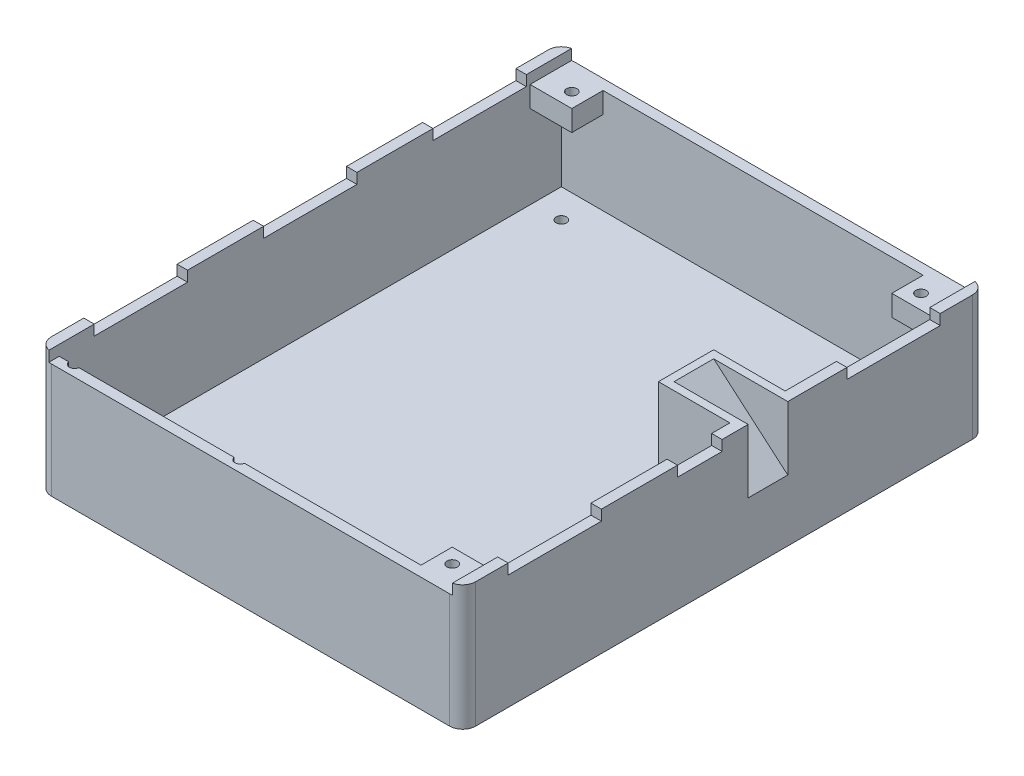
from build123d import *

# Parameters (mm, degrees)
BOSS_EXTRUDE2_DEPTH   = 4
SKETCH1_W             = 4.0000000000000036
SKETCH1_H             = 29.19999999999999
BOSS_EXTRUDE2_2_DEPTH = 4
BOSS_EXTRUDE2_3_DEPTH = 4
BOSS_EXTRUDE2_4_DEPTH = 4
SKETCH1_W_2           = 4
SKETCH1_H_2           = 17.435500273431558
BOSS_EXTRUDE2_5_DEPTH = 4
BOSS_EXTRUDE2_6_DEPTH = 4
BOSS_EXTRUDE2_7_DEPTH = 4
SKETCH1_H_3           = 17.43550027343155
BOSS_EXTRUDE2_8_DEPTH = 4
CUT_EXTRUDE1_DEPTH    = 4
SKETCH3_W             = 162.8
SKETCH3_H             = 200.6710005468631
BOSS_EXTRUDE3_DEPTH   = 40
SKETCH4_W             = 162.8
SKETCH4_H             = 200.6710005468631
BOSS_EXTRUDE4_DEPTH   = 4
FILLET1_R             = 5
FILLET2_R             = 5
FILLET3_R             = 5
FILLET4_R             = 5
SKETCH5_R             = 1.9999999999999967
SKETCH5_R_2           = 2
SKETCH5_R_3           = 2.0000000000000036
CUT_EXTRUDE2_DEPTH    = 4
BOSS_EXTRUDE5_DEPTH   = 8
SKETCH7_R             = 2.0000000000000036
CUT_EXTRUDE3_DEPTH    = 8
SKETCH8_W             = 16
SKETCH8_H             = 12
BOSS_EXTRUDE6_DEPTH   = 8
SKETCH9_R             = 1.9999999999999967
CUT_EXTRUDE4_DEPTH    = 8
SKETCH11_R            = 2
SKETCH11_R_2          = 1.9999999999999967
CUT_EXTRUDE5_DEPTH    = 8
SKETCH12_W            = 15.199999999999989
SKETCH12_H            = 20.419999999999987
CUT_EXTRUDE6_DEPTH    = 4
BOSS_EXTRUDE7_DEPTH   = 44
SKETCH14_W            = 24.419999999999987
SKETCH14_H            = 15.199999999999989
BOSS_EXTRUDE8_DEPTH   = 19.58
CHAMFER2_SIZE2        = 24.42
CHAMFER2_SIZE         = 28.42


with BuildPart() as part:
    # Sketch1 → Boss-Extrude2 (new body)
    with BuildSketch(Plane(origin=(0, 95.46497129757712, 0), x_dir=(1, 0, 0), z_dir=(0, 1, 0))):
        Polygon((5.580685050864992, -64.97044696543385), (5.580685050864992, -47.5349466920023), (1.580685050864986, -47.5349466920023), (1.5806850508649888, -64.97044696543384), align=None)
    extrude(amount=-BOSS_EXTRUDE2_DEPTH)



with BuildPart() as body_2:
    # Sketch1 → Boss-Extrude2 2 (new body)
    with BuildSketch(Plane(origin=(0, 95.46497129757712, 0), x_dir=(1, 0, 0), z_dir=(0, 1, 0))):
        with Locations((3.5806850508649903, -115.37044696543384)):
            Rectangle(SKETCH1_W, SKETCH1_H)
    extrude(amount=-BOSS_EXTRUDE2_2_DEPTH)


with BuildPart() as body_3:
    # Sketch1 → Boss-Extrude2 3 (new body)
    with BuildSketch(Plane(origin=(0, 95.46497129757712, 0), x_dir=(1, 0, 0), z_dir=(0, 1, 0))):
        Polygon((5.580685050864992, -165.77044696543385), (1.5806850508649957, -165.77044696543385), (1.5806850508649888, -194.97044696543384), (5.580685050864992, -194.97044696543384), align=None)
    extrude(amount=-BOSS_EXTRUDE2_3_DEPTH)


with BuildPart() as body_4:
    # Sketch1 → Boss-Extrude2 4 (new body)
    with BuildSketch(Plane(origin=(0, 95.46497129757712, 0), x_dir=(1, 0, 0), z_dir=(0, 1, 0))):
        Polygon((5.580685050864992, -230.77044696543385), (1.5806850508649888, -230.77044696543385), (1.5806850508649888, -248.2059472388654), (5.580685050864986, -248.2059472388654), align=None)
    extrude(amount=-BOSS_EXTRUDE2_4_DEPTH)


with BuildPart() as body_5:
    # Sketch1 → Boss-Extrude2 5 (new body)
    with BuildSketch(Plane(origin=(0, 95.46497129757712, 0), x_dir=(1, 0, 0), z_dir=(0, 1, 0))):
        with Locations((162.380685050865, -239.48819710214963)):
            Rectangle(SKETCH1_W_2, SKETCH1_H_2)
    extrude(amount=-BOSS_EXTRUDE2_5_DEPTH)


with BuildPart() as body_6:
    # Sketch1 → Boss-Extrude2 6 (new body)
    with BuildSketch(Plane(origin=(0, 95.46497129757712, 0), x_dir=(1, 0, 0), z_dir=(0, 1, 0))):
        with Locations((162.380685050865, -180.37044696543384)):
            Rectangle(SKETCH1_W_2, SKETCH1_H)
    extrude(amount=-BOSS_EXTRUDE2_6_DEPTH)


with BuildPart() as body_7:
    # Sketch1 → Boss-Extrude2 7 (new body)
    with BuildSketch(Plane(origin=(0, 95.46497129757712, 0), x_dir=(1, 0, 0), z_dir=(0, 1, 0))):
        Polygon((164.380685050865, -148.66643660097685), (164.380685050865, -100.77044696543385), (160.380685050865, -100.77044696543385), (160.380685050865, -123.46643660097686), (136.36222349016015, -123.46643660097686), (136.36222349016015, -138.66643660097685), (160.380685050865, -138.66643660097685), (160.380685050865, -148.66643660097685), align=None)
    extrude(amount=-BOSS_EXTRUDE2_7_DEPTH)

    # Sketch2 → Cut-Extrude1 (cut)
    with BuildSketch(Plane(origin=(0, 95.46497129757712, 0), x_dir=(1, 0, 0), z_dir=(0, 1, 0))):
        Polygon((160.380685050865, -123.46643660097686), (136.36222349016015, -123.46643660097686), (136.36222349016015, -138.66643660097685), (160.380685050865, -138.66643660097685), (164.380685050865, -138.66643660097685), (164.380685050865, -123.46643660097686), align=None)
    extrude(amount=-CUT_EXTRUDE1_DEPTH, mode=Mode.SUBTRACT)


with BuildPart() as body_8:
    # Sketch1 → Boss-Extrude2 8 (new body)
    with BuildSketch(Plane(origin=(0, 95.46497129757712, 0), x_dir=(1, 0, 0), z_dir=(0, 1, 0))):
        with Locations((162.380685050865, -56.25269682871807)):
            Rectangle(SKETCH1_W_2, SKETCH1_H_3)
    extrude(amount=-BOSS_EXTRUDE2_8_DEPTH)


with BuildPart() as cut_extrude1_piece_1:
    # of the separate pieces the step leaves, piece 1, a body of its own (cut_extrude1_pieces)
    add(body_7.part.solids().sort_by_distance((164.380685051, 95.464971298, 123.466436601))[0])


with BuildPart() as cut_extrude1_piece_2:
    # of the separate pieces the step leaves, piece 2, a body of its own (cut_extrude1_pieces)
    add(body_7.part.solids().sort_by_distance((164.380685051, 95.464971298, 148.666436601))[0])


with BuildPart() as part_1:
    add(part.part)

    add(body_2.part)  # Boss-Extrude3 merges body 2

    add(body_3.part)  # Boss-Extrude3 merges body 3

    add(body_4.part)  # Boss-Extrude3 merges body 4

    add(body_5.part)  # Boss-Extrude3 merges body 5

    add(body_6.part)  # Boss-Extrude3 merges body 6

    add(body_8.part)  # Boss-Extrude3 merges body 8

    add(cut_extrude1_piece_1.part)  # Boss-Extrude3 merges Cut-Extrude1 piece 1

    add(cut_extrude1_piece_2.part)  # Boss-Extrude3 merges Cut-Extrude1 piece 2
    # Sketch3 → Boss-Extrude3 (add)
    with BuildSketch(Plane.XZ.offset(-91.46497129757712)):
        with Locations((82.98068505086499, 147.87044696543384)):
            Rectangle(SKETCH3_W, SKETCH3_H)
        Polygon((160.380685050865, 51.5349466920023), (160.380685050865, 244.2059472388654), (5.580685050864989, 244.2059472388654), (5.580685050864981, 51.5349466920023), align=None, mode=Mode.SUBTRACT)
    extrude(amount=BOSS_EXTRUDE3_DEPTH)

    # Sketch4 → Boss-Extrude4 (add)
    with BuildSketch(Plane.XZ.offset(-51.46497129757712)):
        with Locations((82.98068505086499, 147.87044696543384)):
            Rectangle(SKETCH4_W, SKETCH4_H)
    extrude(amount=BOSS_EXTRUDE4_DEPTH)

    # Fillet1
    fillet1_edges = [part_1.edges().sort_by_distance(p)[0] for p in [
        (1.5806850508649881, 71.46497129757712, 248.2059472388654),
    ]]
    fillet(fillet1_edges, radius=FILLET1_R)

    # Fillet2
    fillet2_edges = [part_1.edges().sort_by_distance(p)[0] for p in [
        (164.380685050865, 71.46497129757712, 248.2059472388654),
    ]]
    fillet(fillet2_edges, radius=FILLET2_R)

    # Fillet3
    fillet3_edges = [part_1.edges().sort_by_distance(p)[0] for p in [
        (164.380685050865, 71.46497129757712, 47.53494669200231),
    ]]
    fillet(fillet3_edges, radius=FILLET3_R)

    # Fillet4
    fillet4_edges = [part_1.edges().sort_by_distance(p)[0] for p in [
        (1.5806850508649881, 71.46497129757712, 47.53494669200231),
    ]]
    fillet(fillet4_edges, radius=FILLET4_R)

    # Sketch5 → Cut-Extrude2 (cut)
    with BuildSketch(Plane.XZ.offset(-47.46497129757712)):
        with Locations(Location((149.380685050865, 62.53494669200229, 0), (0, 0, 270))):
            Circle(SKETCH5_R)
        with Locations(Location((16.580685050864986, 62.53494669200231, 0), (0, 0, 270))):
            Circle(SKETCH5_R_2)
        with Locations(Location((149.380685050865, 233.20594723886538, 0), (0, 0, 270))):
            Circle(SKETCH5_R)
        with Locations(Location((16.58068505086499, 233.2059472388654, 0), (0, 0, 270))):
            Circle(SKETCH5_R_3)
    extrude(amount=-CUT_EXTRUDE2_DEPTH, mode=Mode.SUBTRACT)

    # Sketch6 → Boss-Extrude5 (add)
    with BuildSketch(Plane(origin=(0, 91.46497129757712, 0), x_dir=(1, 0, 0), z_dir=(0, 1, 0))):
        Polygon((21.580685050864982, -63.534946692002315), (21.580685050864975, -51.5349466920023), (5.580685050864992, -51.5349466920023), (5.580685050864982, -63.53494669200232), align=None)
    boss_extrude5 = extrude(amount=-BOSS_EXTRUDE5_DEPTH)

    # Sketch7 → Cut-Extrude3 (cut)
    with BuildSketch(Plane(origin=(0, 91.46497129757712, 0), x_dir=(1, 0, 0), z_dir=(0, 1, 0))):
        with Locations(Location((15.980685050864993, -57.934946692002306, 0), (0, 0, 270))):
            Circle(SKETCH7_R)
    cut_extrude3 = extrude(amount=-CUT_EXTRUDE3_DEPTH, mode=Mode.SUBTRACT)

    # Mirror1: Boss-Extrude5, Cut-Extrude3 across plane
    add(boss_extrude5.mirror(Plane.ZY.offset(-82.980685050865)))
    add(cut_extrude3.mirror(Plane.ZY.offset(-82.980685050865)), mode=Mode.SUBTRACT)

    # Sketch8 → Boss-Extrude6 (add)
    with BuildSketch(Plane(origin=(0, 91.46497129757712, 0), x_dir=(1, 0, 0), z_dir=(0, 1, 0))):
        with Locations((152.380685050865, -238.2059472388654)):
            Rectangle(SKETCH8_W, SKETCH8_H)
    extrude(amount=-BOSS_EXTRUDE6_DEPTH)

    # Sketch9 → Cut-Extrude4 (cut)
    with BuildSketch(Plane(origin=(0, 91.46497129757712, 0), x_dir=(1, 0, 0), z_dir=(0, 1, 0))):
        with Locations(Location((149.98068505086505, -237.8059472388654, 0), (0, 0, 270))):
            Circle(SKETCH9_R)
    extrude(amount=-CUT_EXTRUDE4_DEPTH, mode=Mode.SUBTRACT)

    # Sketch11 → Cut-Extrude5 (cut)
    with BuildSketch(Plane(origin=(0, 91.46497129757712, 0), x_dir=(1, 0, 0), z_dir=(0, 1, 0))):
        with Locations((11.180685050864989, -243.87594723886542)):
            Circle(SKETCH11_R)
        with Locations((74.680685050865, -243.87594723886542)):
            Circle(SKETCH11_R_2)
    extrude(amount=-CUT_EXTRUDE5_DEPTH, mode=Mode.SUBTRACT)

    # Sketch12 → Cut-Extrude6 (cut)
    with BuildSketch(Plane(origin=(164.380685050865, 0, 0), x_dir=(0, 0, -1), z_dir=(1, 0, 0))):
        with Locations((-131.06643660097686, 81.25497129757713)):
            Rectangle(SKETCH12_W, SKETCH12_H)
    extrude(amount=-CUT_EXTRUDE6_DEPTH, mode=Mode.SUBTRACT)

    # Sketch13 → Boss-Extrude7 (add)
    with BuildSketch(Plane(origin=(0, 51.46497129757712, 0), x_dir=(1, 0, 0), z_dir=(0, 1, 0))):
        Polygon((135.960685050865, -123.46643660097686), (160.380685050865, -123.46643660097686), (160.380685050865, -120.46643660097686), (132.960685050865, -120.46643660097686), (132.960685050865, -141.66643660097685), (160.380685050865, -141.66643660097685), (160.380685050865, -138.66643660097685), (135.960685050865, -138.66643660097685), align=None)
    extrude(amount=BOSS_EXTRUDE7_DEPTH)

    # Sketch14 → Boss-Extrude8 (add)
    with BuildSketch(Plane(origin=(0, 51.46497129757712, 0), x_dir=(1, 0, 0), z_dir=(0, 1, 0))):
        with Locations((148.17068505086502, -131.06643660097686)):
            Rectangle(SKETCH14_W, SKETCH14_H)
    extrude(amount=BOSS_EXTRUDE8_DEPTH)

    # Chamfer2
    chamfer2_edges = [part_1.edges().sort_by_distance(p)[0] for p in [
        (135.960685050865, 71.04497129757712, 131.06643660097686),
    ]]
    chamfer2_side = [part_1.faces().sort_by_distance(p)[0] for p in [
        (136.44908505086502, 71.04497129757712, 131.06643660097686),
    ]]
    chamfer(chamfer2_edges, length=CHAMFER2_SIZE - 0.0001, length2=CHAMFER2_SIZE2 - 0.0001, reference=chamfer2_side[0])  # a hair under: the kernel refuses the full size


solid = part_1.part
